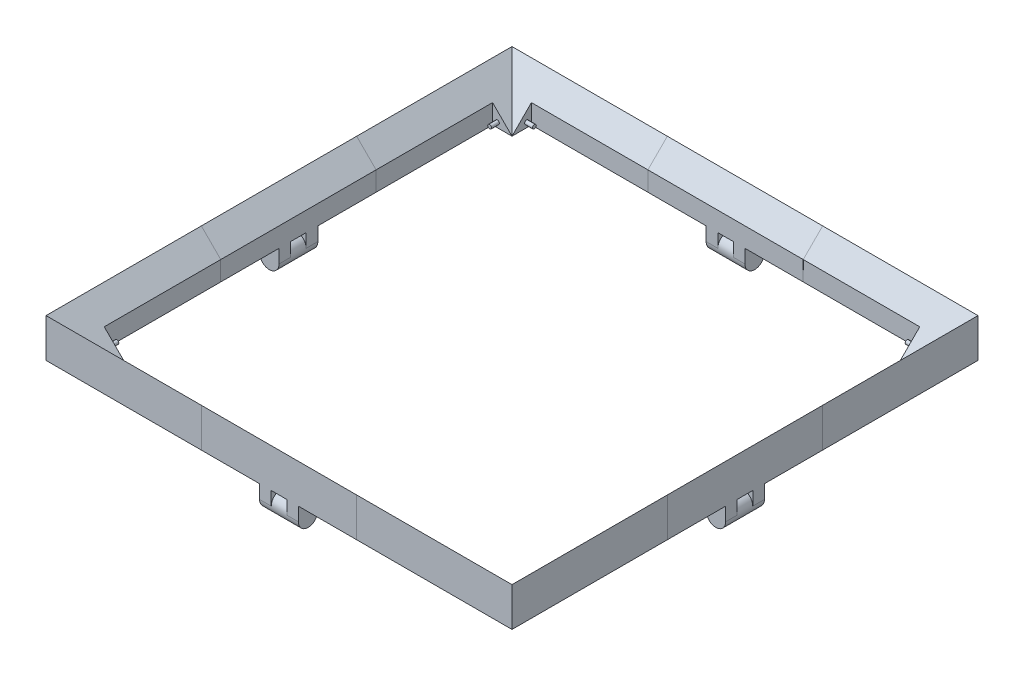
from build123d import *

# Parameters (mm, degrees)
SKETCH1_W                                  = 700
SKETCH1_H                                  = 700
SKETCH1_W_2                                = 500
SKETCH1_H_2                                = 500
BOSS_EXTRUDE2_DEPTH                        = 50
BOSS_EXTRUDE2_DRAFT                        = 45
SKETCH6_W                                  = 700
SKETCH6_H                                  = 700
SKETCH6_W_2                                = 600
SKETCH6_H_2                                = 600
CUT_EXTRUDE1_DEPTH                         = 50
CUT_EXTRUDE2_DEPTH                         = 25
SKETCH8_R                                  = 2.5
BOSS_EXTRUDE3_DEPTH                        = 10
MIRROR1_AT_THE_SECOND_PLANE_COPY_1_SKETC_R = 2.5
MIRROR1_AT_THE_SECOND_PLANE_COPY_1_DEPTH   = 10
MIRROR2_COPY_1_SKETCH_R                    = 2.5
MIRROR2_COPY_1_DEPTH                       = 10
MIRROR2_COPY_2_SKETCH_R                    = 2.5
MIRROR2_COPY_2_DEPTH                       = 10
MIRROR2_COPY_3_SKETCH_R                    = 2.5
MIRROR2_COPY_3_DEPTH                       = 10
SKETCH9_W                                  = 25
SKETCH9_H                                  = 15
BOSS_EXTRUDE4_DEPTH                        = 30
SKETCH11_R                                 = 12.5
BOSS_EXTRUDE5_DEPTH                        = 50
FILLET1_R                                  = 12.5
FILLET1_OF_MIRROR3_R                       = 12.5
MIRROR4_START                              = -25
MIRROR4_OUTLINE_R                          = 12.5
MIRROR4_DEPTH                              = 50
MIRROR4_2_DEPTH                            = 15
MIRROR4_START_2                            = 10
MIRROR4_3_DEPTH                            = 15
INTERSECT1_START                           = -300
INTERSECT1_DEPTH                           = 200
INTERSECT1_2_DEPTH                         = 50
INTERSECT1_START_2                         = -250
INTERSECT1_3_OUTLINE_R                     = 2.5
INTERSECT1_3_DEPTH                         = 10
INTERSECT1_4_DEPTH                         = 200
INTERSECT1_START_3                         = -279.452
INTERSECT1_5_DEPTH                         = 29.452
INTERSECT1_6_OUTLINE_R                     = 2.5
INTERSECT1_6_DEPTH                         = 10
INTERSECT1_7_DEPTH                         = 600
INTERSECT1_8_DEPTH                         = 200
INTERSECT1_START_4                         = 100
INTERSECT1_9_DEPTH                         = 200
INTERSECT1_START_5                         = -100
INTERSECT1_10_DEPTH                        = 200
INTERSECT1_START_6                         = -25
INTERSECT1_11_OUTLINE_R                    = 12.5
INTERSECT1_11_DEPTH                        = 50
INTERSECT1_12_DEPTH                        = 15
INTERSECT1_START_7                         = 10
INTERSECT1_13_DEPTH                        = 15
INTERSECT1_14_DEPTH                        = 200
INTERSECT1_START_8                         = 250
INTERSECT1_15_DEPTH                        = 50
INTERSECT1_START_9                         = 240
INTERSECT1_16_OUTLINE_R                    = 2.5
INTERSECT1_16_DEPTH                        = 10
INTERSECT1_17_DEPTH                        = 200
INTERSECT1_START_10                        = -280.548
INTERSECT1_18_DEPTH                        = 30.548
INTERSECT1_19_OUTLINE_R                    = 2.5
INTERSECT1_19_DEPTH                        = 10
INTERSECT1_20_DEPTH                        = 200
INTERSECT1_21_OUTLINE_R                    = 12.5
INTERSECT1_21_DEPTH                        = 50
INTERSECT1_22_DEPTH                        = 15
INTERSECT1_23_DEPTH                        = 15
INTERSECT1_24_DEPTH                        = 200
INTERSECT1_25_OUTLINE_R                    = 12.5
INTERSECT1_25_DEPTH                        = 50
INTERSECT1_26_DEPTH                        = 15
INTERSECT1_27_DEPTH                        = 15
INTERSECT1_28_DEPTH                        = 200
INTERSECT1_29_DEPTH                        = 50
INTERSECT1_30_OUTLINE_R                    = 2.5
INTERSECT1_30_DEPTH                        = 10
INTERSECT1_31_DEPTH                        = 200
INTERSECT1_32_DEPTH                        = 30.548
INTERSECT1_33_OUTLINE_R                    = 2.5
INTERSECT1_33_DEPTH                        = 10
INTERSECT1_34_DEPTH                        = 200
INTERSECT1_35_DEPTH                        = 50
INTERSECT1_36_OUTLINE_R                    = 2.5
INTERSECT1_36_DEPTH                        = 10
INTERSECT1_37_DEPTH                        = 200
INTERSECT1_38_DEPTH                        = 30.548
INTERSECT1_39_OUTLINE_R                    = 2.5
INTERSECT1_39_DEPTH                        = 10


with BuildPart() as part:
    # Sketch1 → Boss-Extrude2 (with draft: the straight prism first)
    with BuildSketch(Plane(origin=(0, 0, 0), x_dir=(1, 0, 0), z_dir=(0, 1, 0))):
        Rectangle(SKETCH1_W, SKETCH1_H)
        Rectangle(SKETCH1_W_2, SKETCH1_H_2, mode=Mode.SUBTRACT)
    extrude(amount=BOSS_EXTRUDE2_DEPTH)
    # Boss-Extrude2: the draft: its side faces are tilted about the plane it starts from
    boss_extrude2_sides = [part.faces().sort_by_distance(p)[0] for p in [
        (-350, 25, 0),
        (0, 25, 350),
        (350, 25, 0),
        (0, 25, -350),
        (250, 25, 0),
        (0, 25, 250),
        (-250, 25, 0),
        (0, 25, -250),
    ]]
    draft(boss_extrude2_sides, Plane(origin=(0, 0, 0), x_dir=(1, 0, 0), z_dir=(0, 1, 0)), BOSS_EXTRUDE2_DRAFT)

    # Sketch6 → Cut-Extrude1 (cut)
    with BuildSketch(Plane(origin=(0, 50, 0), x_dir=(1, 0, 0), z_dir=(0, 1, 0))):
        Rectangle(SKETCH6_W, SKETCH6_H)
        Rectangle(SKETCH6_W_2, SKETCH6_H_2, mode=Mode.SUBTRACT)
    extrude(amount=-CUT_EXTRUDE1_DEPTH, mode=Mode.SUBTRACT)

    # Sketch7 → Cut-Extrude2 (cut)
    with BuildSketch(Plane.XZ):
        Polygon((-275, 250), (-250, 250), (-250, 275), (250, 275), (250, 250), (275, 250), (275, -250), (250, -250), (250, -275), (-250, -275), (-250, -250), (-275, -250), align=None)
    extrude(amount=-CUT_EXTRUDE2_DEPTH, mode=Mode.SUBTRACT)

    # Sketch8 → Boss-Extrude3 (add)
    with BuildSketch(Plane.XY.offset(-250)):
        with Locations(Location((-268.75, 6.25, 0), (0, 0, 180))):
            Circle(SKETCH8_R)
    boss_extrude3 = extrude(amount=BOSS_EXTRUDE3_DEPTH)

    # Mirror1: Boss-Extrude3 across plane
    add(boss_extrude3.mirror(Plane(origin=(0, 0, 0), x_dir=(0, 0, 1), z_dir=(1, 0, 0))))

    # Mirror1 at the second plane: Boss-Extrude3 across plane
    add(boss_extrude3.mirror(Plane.XY))

    # Mirror1 at the second plane copy 1 sketc → Mirror1 at the second plane copy 1 (add)
    with BuildSketch(Plane(origin=(0, 0, 250), x_dir=(-1, 0, 0), z_dir=(0, 0, -1))):
        with Locations(Location((-268.75, 6.25, 0), (0, 0, 180))):
            Circle(MIRROR1_AT_THE_SECOND_PLANE_COPY_1_SKETC_R)
    extrude(amount=MIRROR1_AT_THE_SECOND_PLANE_COPY_1_DEPTH)

    # Mirror2: Boss-Extrude3 across plane
    add(boss_extrude3.mirror(Plane(origin=(0, 0, 0), x_dir=(0.7071067811865477, 0, 0.7071067811865474), z_dir=(-0.7071067811865474, 0, 0.7071067811865477))))

    # Mirror2 copy 1 sketch → Mirror2 copy 1 (add)
    with BuildSketch(Plane(origin=(-250, 0, 0), x_dir=(0, 0, -1), z_dir=(1, 0, 0))):
        with Locations(Location((-268.75, 6.25, 0), (0, 0, 180))):
            Circle(MIRROR2_COPY_1_SKETCH_R)
    extrude(amount=MIRROR2_COPY_1_DEPTH)

    # Mirror2 copy 2 sketch → Mirror2 copy 2 (add)
    with BuildSketch(Plane.ZY.offset(-250)):
        with Locations(Location((-268.75, 6.25, 0), (0, 0, 180))):
            Circle(MIRROR2_COPY_2_SKETCH_R)
    extrude(amount=MIRROR2_COPY_2_DEPTH)

    # Mirror2 copy 3 sketch → Mirror2 copy 3 (add)
    with BuildSketch(Plane(origin=(250, 0, 0), x_dir=(0, 0, -1), z_dir=(-1, 0, 0))):
        with Locations((-268.75, -6.25)):
            Circle(MIRROR2_COPY_3_SKETCH_R)
    extrude(amount=MIRROR2_COPY_3_DEPTH)

    # Sketch9 → Boss-Extrude4 (add)
    with BuildSketch(Plane.XZ):
        with Locations((-287.5, 17.5)):
            Rectangle(SKETCH9_W, SKETCH9_H)
        with Locations((-287.5, -17.5)):
            Rectangle(SKETCH9_W, SKETCH9_H)
    boss_extrude4 = extrude(amount=BOSS_EXTRUDE4_DEPTH)

    # Sketch11 → Boss-Extrude5 (add)
    with BuildSketch(Plane(origin=(0, 0, -25), x_dir=(-1, 0, 0), z_dir=(0, 0, -1))):
        with Locations((287.5, -17.5)):
            Circle(SKETCH11_R)
    boss_extrude5 = extrude(amount=-BOSS_EXTRUDE5_DEPTH)

    # Fillet1
    fillet1_edges = [part.edges().sort_by_distance(p)[0] for p in [
        (-275, -30, -17.5),
        (-275, -30, 17.5),
        (-300, -30, 17.5),
        (-300, -30, -17.5),
    ]]
    fillet(fillet1_edges, radius=FILLET1_R - 0.0001)  # a hair under: the kernel refuses the full size

    # Mirror3: Boss-Extrude4, Boss-Extrude5 across plane
    add(boss_extrude4.mirror(Plane(origin=(0, 0, 0), x_dir=(0, 0, 1), z_dir=(1, 0, 0))))
    add(boss_extrude5.mirror(Plane(origin=(0, 0, 0), x_dir=(0, 0, 1), z_dir=(1, 0, 0))))

    # Fillet1 of Mirror3
    fillet1_of_mirror3_edges = [part.edges().sort_by_distance(p)[0] for p in [
        (275, -30, -17.5),
        (275, -30, 17.5),
        (300, -30, 17.5),
        (300, -30, -17.5),
    ]]
    fillet(fillet1_of_mirror3_edges, radius=FILLET1_OF_MIRROR3_R - 0.0001)  # a hair under: the kernel refuses the full size



with BuildPart() as body_2:
    # Mirror4: read off the stored shape, not the designer's step
    # Mirror4 outline → Mirror4 (new body)
    with BuildSketch(Plane.YZ.offset(MIRROR4_START)):
        with Locations((-17.5, 287.5)):
            Circle(MIRROR4_OUTLINE_R)
        with Locations((-17.5, -287.5)):
            Circle(MIRROR4_OUTLINE_R)
    extrude(amount=MIRROR4_DEPTH)


with BuildPart() as part_1:
    add(part.part)

    add(body_2.part)  # Mirror4 2 merges body 2
    # Mirror4 2 outline → Mirror4 2 (add)
    with BuildSketch(Plane.YZ.offset(MIRROR4_START)):
        with BuildLine():
            ThreePointArc((-17.5, 300), (-5, 287.5), (-17.5, 275))
            Line((-17.5, 275), (0, 275))
            Line((0, 275), (0, 300))
            Line((0, 300), (-17.5, 300))
        make_face()
        with BuildLine():
            ThreePointArc((-17.5, -275), (-5, -287.5), (-17.5, -300))
            Line((-17.5, -300), (0, -300))
            Line((0, -300), (0, -275))
            Line((0, -275), (-17.5, -275))
        make_face()
    extrude(amount=MIRROR4_2_DEPTH)

    # Mirror4 3 outline → Mirror4 3 (add)
    with BuildSketch(Plane.YZ.offset(MIRROR4_START_2)):
        with BuildLine():
            ThreePointArc((-17.5, 300), (-5, 287.5), (-17.5, 275))
            Line((-17.5, 275), (0, 275))
            Line((0, 275), (0, 300))
            Line((0, 300), (-17.5, 300))
        make_face()
        with BuildLine():
            ThreePointArc((-17.5, -275), (-5, -287.5), (-17.5, -300))
            Line((-17.5, -300), (0, -300))
            Line((0, -300), (0, -275))
            Line((0, -275), (-17.5, -275))
        make_face()
    extrude(amount=MIRROR4_3_DEPTH)

    # Intersect1 7 outline → Intersect1 7 (cut)
    with BuildSketch(Plane.XY.offset(INTERSECT1_START)):
        Polygon((302, 52), (-302, 52), (-302, 0), (-300, 0), (-300, 50), (-275, 25), (-275, -32), (302, -32), align=None)
    extrude(amount=INTERSECT1_7_DEPTH, mode=Mode.SUBTRACT)

    # Intersect1 8 outline → Intersect1 8 (cut)
    with BuildSketch(Plane.XY.offset(INTERSECT1_START)):
        Polygon((-300, 0), (-275, 0), (-275, 25), (-300, 50), align=None)
    extrude(amount=INTERSECT1_8_DEPTH, mode=Mode.SUBTRACT)

    # Intersect1 9 outline → Intersect1 9 (cut)
    with BuildSketch(Plane.XY.offset(INTERSECT1_START_4)):
        Polygon((-300, 0), (-275, 0), (-275, 25), (-300, 50), align=None)
    extrude(amount=INTERSECT1_9_DEPTH, mode=Mode.SUBTRACT)


with BuildPart() as body_2_2:
    # Intersect1: read off the stored shape, not the designer's step
    # Intersect1 outline → Intersect1 (new body)
    with BuildSketch(Plane.YZ.offset(INTERSECT1_START)):
        Polygon((0, -275), (0, -300), (50, -300), (25, -275), align=None)
    extrude(amount=INTERSECT1_DEPTH)

    # Intersect1 2 outline → Intersect1 2 (add)
    with BuildSketch(Plane.YZ.offset(INTERSECT1_START)):
        Polygon((0, -250), (0, -275), (25, -275), align=None)
    extrude(amount=INTERSECT1_2_DEPTH)

    # Intersect1 3 outline → Intersect1 3 (add)
    with BuildSketch(Plane.YZ.offset(INTERSECT1_START_2)):
        with Locations((6.25, -268.75)):
            Circle(INTERSECT1_3_OUTLINE_R)
    extrude(amount=INTERSECT1_3_DEPTH)

    # Intersect1 4 outline → Intersect1 4 (add)
    with BuildSketch(Plane.XY.offset(INTERSECT1_START)):
        Polygon((-275, 25), (-300, 50), (-300, 0), (-275, 0), align=None)
    extrude(amount=INTERSECT1_4_DEPTH)

    # Intersect1 5 outline → Intersect1 5 (add)
    with BuildSketch(Plane.XY.offset(INTERSECT1_START_3)):
        Polygon((-250, 0), (-275, 25), (-275, 0), align=None)
    extrude(amount=INTERSECT1_5_DEPTH)

    # Intersect1 6 outline → Intersect1 6 (add)
    with BuildSketch(Plane.XY.offset(INTERSECT1_START_2)):
        with Locations((-268.75, 6.25)):
            Circle(INTERSECT1_6_OUTLINE_R)
    extrude(amount=INTERSECT1_6_DEPTH)


with BuildPart() as body_3:
    # Intersect1 10 outline → Intersect1 10 (new body)
    with BuildSketch(Plane.YZ.offset(INTERSECT1_START_5)):
        Polygon((0, -275), (0, -300), (50, -300), (25, -275), align=None)
    extrude(amount=INTERSECT1_10_DEPTH)

    # Intersect1 11 outline → Intersect1 11 (add)
    with BuildSketch(Plane.YZ.offset(INTERSECT1_START_6)):
        with Locations((-17.5, -287.5)):
            Circle(INTERSECT1_11_OUTLINE_R)
    extrude(amount=INTERSECT1_11_DEPTH)

    # Intersect1 12 outline → Intersect1 12 (add)
    with BuildSketch(Plane.YZ.offset(INTERSECT1_START_6)):
        with BuildLine():
            Line((-17.5, -300), (0, -300))
            Line((0, -300), (0, -275))
            Line((0, -275), (-17.5, -275))
            ThreePointArc((-17.5, -275), (-5, -287.5), (-17.5, -300))
        make_face()
    extrude(amount=INTERSECT1_12_DEPTH)

    # Intersect1 13 outline → Intersect1 13 (add)
    with BuildSketch(Plane.YZ.offset(INTERSECT1_START_7)):
        with BuildLine():
            Line((-17.5, -300), (0, -300))
            Line((0, -300), (0, -275))
            Line((0, -275), (-17.5, -275))
            ThreePointArc((-17.5, -275), (-5, -287.5), (-17.5, -300))
        make_face()
    extrude(amount=INTERSECT1_13_DEPTH)


with BuildPart() as body_4:
    # Intersect1 14 outline → Intersect1 14 (new body)
    with BuildSketch(Plane.YZ.offset(INTERSECT1_START_4)):
        Polygon((0, -275), (0, -300), (50, -300), (25, -275), align=None)
    extrude(amount=INTERSECT1_14_DEPTH)

    # Intersect1 15 outline → Intersect1 15 (add)
    with BuildSketch(Plane.YZ.offset(INTERSECT1_START_8)):
        Polygon((0, -250), (0, -275), (25, -275), align=None)
    extrude(amount=INTERSECT1_15_DEPTH)

    # Intersect1 16 outline → Intersect1 16 (add)
    with BuildSketch(Plane.YZ.offset(INTERSECT1_START_9)):
        with Locations((6.25, -268.75)):
            Circle(INTERSECT1_16_OUTLINE_R)
    extrude(amount=INTERSECT1_16_DEPTH)

    # Intersect1 17 outline → Intersect1 17 (add)
    with BuildSketch(Plane.XY.offset(INTERSECT1_START)):
        Polygon((275, 0), (300, 0), (300, 50), (275, 25), align=None)
    extrude(amount=INTERSECT1_17_DEPTH)

    # Intersect1 18 outline → Intersect1 18 (add)
    with BuildSketch(Plane.XY.offset(INTERSECT1_START_10)):
        Polygon((250, 0), (275, 0), (275, 25), align=None)
    extrude(amount=INTERSECT1_18_DEPTH)

    # Intersect1 19 outline → Intersect1 19 (add)
    with BuildSketch(Plane.XY.offset(INTERSECT1_START_2)):
        with Locations((268.75, 6.25)):
            Circle(INTERSECT1_19_OUTLINE_R)
    extrude(amount=INTERSECT1_19_DEPTH)


with BuildPart() as body_5:
    # Intersect1 20 outline → Intersect1 20 (new body)
    with BuildSketch(Plane.XY.offset(INTERSECT1_START_5)):
        Polygon((275, 0), (300, 0), (300, 50), (275, 25), align=None)
    extrude(amount=INTERSECT1_20_DEPTH)

    # Intersect1 21 outline → Intersect1 21 (add)
    with BuildSketch(Plane.XY.offset(INTERSECT1_START_6)):
        with Locations((287.5, -17.5)):
            Circle(INTERSECT1_21_OUTLINE_R)
    extrude(amount=INTERSECT1_21_DEPTH)

    # Intersect1 22 outline → Intersect1 22 (add)
    with BuildSketch(Plane.XY.offset(INTERSECT1_START_6)):
        with BuildLine():
            ThreePointArc((275, -17.5), (287.5, -5), (300, -17.5))
            Line((300, -17.5), (300, 0))
            Line((300, 0), (275, 0))
            Line((275, 0), (275, -17.5))
        make_face()
    extrude(amount=INTERSECT1_22_DEPTH)

    # Intersect1 23 outline → Intersect1 23 (add)
    with BuildSketch(Plane.XY.offset(INTERSECT1_START_7)):
        with BuildLine():
            ThreePointArc((275, -17.5), (287.5, -5), (300, -17.5))
            Line((300, -17.5), (300, 0))
            Line((300, 0), (275, 0))
            Line((275, 0), (275, -17.5))
        make_face()
    extrude(amount=INTERSECT1_23_DEPTH)


with BuildPart() as body_6:
    # Intersect1 24 outline → Intersect1 24 (new body)
    with BuildSketch(Plane.YZ.offset(INTERSECT1_START_5)):
        Polygon((50, 300), (0, 300), (0, 275), (25, 275), align=None)
    extrude(amount=INTERSECT1_24_DEPTH)

    # Intersect1 25 outline → Intersect1 25 (add)
    with BuildSketch(Plane.YZ.offset(INTERSECT1_START_6)):
        with Locations((-17.5, 287.5)):
            Circle(INTERSECT1_25_OUTLINE_R)
    extrude(amount=INTERSECT1_25_DEPTH)

    # Intersect1 26 outline → Intersect1 26 (add)
    with BuildSketch(Plane.YZ.offset(INTERSECT1_START_6)):
        with BuildLine():
            ThreePointArc((-17.5, 300), (-5, 287.5), (-17.5, 275))
            Line((-17.5, 275), (0, 275))
            Line((0, 275), (0, 300))
            Line((0, 300), (-17.5, 300))
        make_face()
    extrude(amount=INTERSECT1_26_DEPTH)

    # Intersect1 27 outline → Intersect1 27 (add)
    with BuildSketch(Plane.YZ.offset(INTERSECT1_START_7)):
        with BuildLine():
            ThreePointArc((-17.5, 300), (-5, 287.5), (-17.5, 275))
            Line((-17.5, 275), (0, 275))
            Line((0, 275), (0, 300))
            Line((0, 300), (-17.5, 300))
        make_face()
    extrude(amount=INTERSECT1_27_DEPTH)


with BuildPart() as body_7:
    # Intersect1 28 outline → Intersect1 28 (new body)
    with BuildSketch(Plane.YZ.offset(INTERSECT1_START)):
        Polygon((0, 275), (25, 275), (50, 300), (0, 300), align=None)
    extrude(amount=INTERSECT1_28_DEPTH)

    # Intersect1 29 outline → Intersect1 29 (add)
    with BuildSketch(Plane.YZ.offset(INTERSECT1_START)):
        Polygon((0, 275), (0, 250), (25, 275), align=None)
    extrude(amount=INTERSECT1_29_DEPTH)

    # Intersect1 30 outline → Intersect1 30 (add)
    with BuildSketch(Plane.YZ.offset(INTERSECT1_START_2)):
        with Locations((6.25, 268.75)):
            Circle(INTERSECT1_30_OUTLINE_R)
    extrude(amount=INTERSECT1_30_DEPTH)

    # Intersect1 31 outline → Intersect1 31 (add)
    with BuildSketch(Plane.XY.offset(INTERSECT1_START_4)):
        Polygon((-275, 25), (-300, 50), (-300, 0), (-275, 0), align=None)
    extrude(amount=INTERSECT1_31_DEPTH)

    # Intersect1 32 outline → Intersect1 32 (add)
    with BuildSketch(Plane.XY.offset(INTERSECT1_START_8)):
        Polygon((-250, 0), (-275, 25), (-275, 0), align=None)
    extrude(amount=INTERSECT1_32_DEPTH)

    # Intersect1 33 outline → Intersect1 33 (add)
    with BuildSketch(Plane.XY.offset(INTERSECT1_START_9)):
        with Locations((-268.75, 6.25)):
            Circle(INTERSECT1_33_OUTLINE_R)
    extrude(amount=INTERSECT1_33_DEPTH)


with BuildPart() as body_8:
    # Intersect1 34 outline → Intersect1 34 (new body)
    with BuildSketch(Plane.XY.offset(INTERSECT1_START_4)):
        Polygon((275, 0), (300, 0), (300, 50), (275, 25), align=None)
    extrude(amount=INTERSECT1_34_DEPTH)

    # Intersect1 35 outline → Intersect1 35 (add)
    with BuildSketch(Plane.XY.offset(INTERSECT1_START_8)):
        Polygon((250, 0), (275, 0), (275, 25), align=None)
    extrude(amount=INTERSECT1_35_DEPTH)

    # Intersect1 36 outline → Intersect1 36 (add)
    with BuildSketch(Plane.XY.offset(INTERSECT1_START_9)):
        with Locations((268.75, 6.25)):
            Circle(INTERSECT1_36_OUTLINE_R)
    extrude(amount=INTERSECT1_36_DEPTH)

    # Intersect1 37 outline → Intersect1 37 (add)
    with BuildSketch(Plane.YZ.offset(INTERSECT1_START_4)):
        Polygon((0, 275), (25, 275), (50, 300), (0, 300), align=None)
    extrude(amount=INTERSECT1_37_DEPTH)

    # Intersect1 38 outline → Intersect1 38 (add)
    with BuildSketch(Plane.YZ.offset(INTERSECT1_START_8)):
        Polygon((0, 275), (0, 250), (25, 275), align=None)
    extrude(amount=INTERSECT1_38_DEPTH)

    # Intersect1 39 outline → Intersect1 39 (add)
    with BuildSketch(Plane.YZ.offset(INTERSECT1_START_9)):
        with Locations((6.25, 268.75)):
            Circle(INTERSECT1_39_OUTLINE_R)
    extrude(amount=INTERSECT1_39_DEPTH)


solid = Compound([part_1.part, body_2_2.part, body_3.part, body_4.part, body_5.part, body_6.part, body_7.part, body_8.part])
